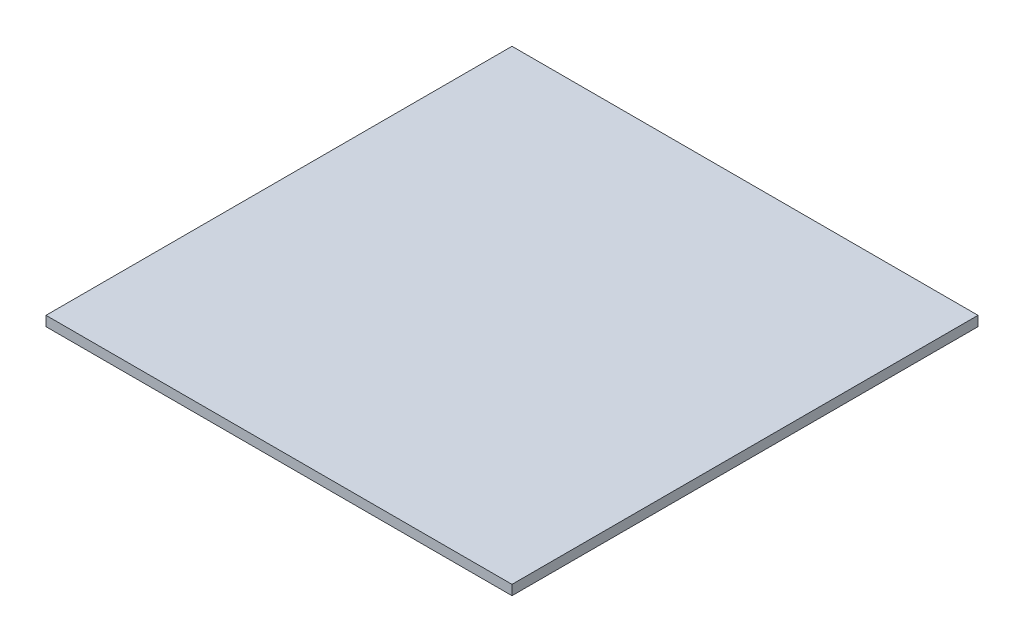
from build123d import *

# Parameters (mm, degrees)
SKETCH1_W           = 299.745999948
SKETCH1_H           = 299.745999948
BOSS_EXTRUDE1_DEPTH = 6.35


with BuildPart() as part:
    # Sketch1 → Boss-Extrude1 (new body)
    with BuildSketch(Plane(origin=(0, 0, 0), x_dir=(1, 0, 0), z_dir=(0, 1, 0))):
        with Locations((149.872999974, 0)):
            Rectangle(SKETCH1_W, SKETCH1_H)
    extrude(amount=BOSS_EXTRUDE1_DEPTH)


solid = part.part
